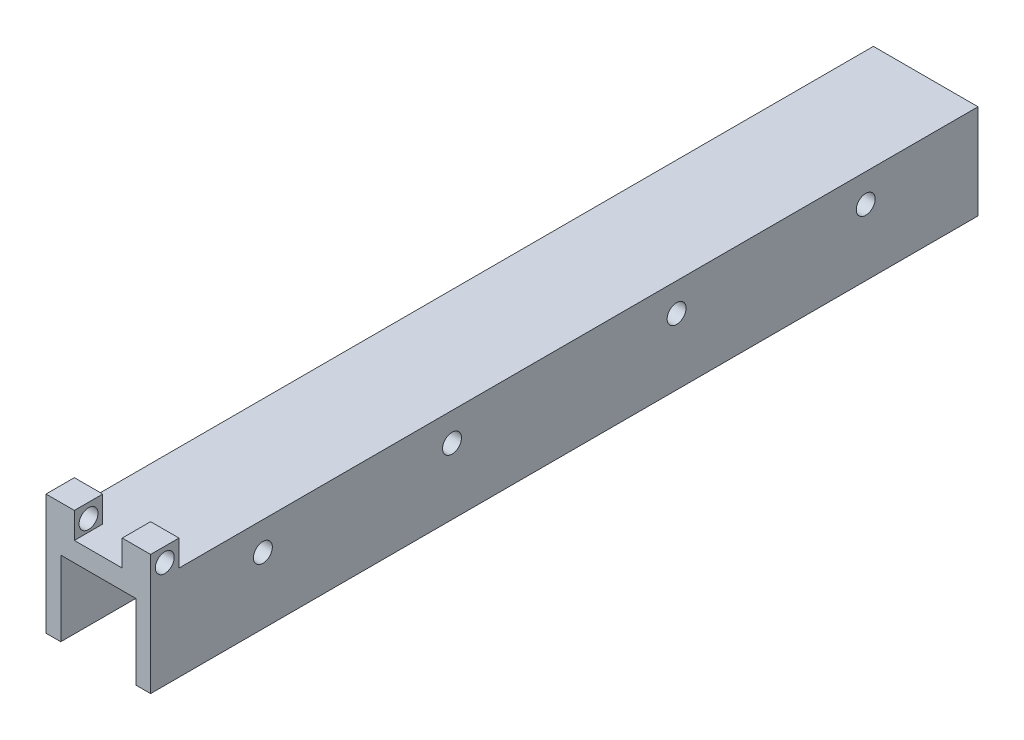
from build123d import *

# Parameters (mm, degrees)
BOSS_EXTRUDE2_DEPTH     = 177.8
SKETCH19_R              = 2.032
CUT_EXTRUDE3_DEPTH      = 181.363654435
SKETCH21_W              = 6.096
SKETCH21_H              = 6.096
BOSS_EXTRUDE4_DEPTH     = 5.588
CUT_EXTRUDE4_DEPTH      = 181.423022791
CUT_EXTRUDE4_DEPTH_BACK = 181.423022791
SKETCH22_R              = 2.032


with BuildPart() as part:
    # Sketch2 → Boss-Extrude2 (new body)
    with BuildSketch(Plane.XY):
        Polygon((0, 0), (0, 20.32), (22.479, 20.32), (22.479, 0), (19.304, 0), (19.304, 16.129), (3.175, 16.129), (3.175, 0), align=None)
    extrude(amount=-BOSS_EXTRUDE2_DEPTH)

    # Sketch19 → Cut-Extrude3 (cut, through all)
    with BuildSketch(Plane(origin=(0, 0, 0), x_dir=(0, 0, -1), z_dir=(1, 0, 0))):
        with Locations((24.13, 14.224)):
            Circle(SKETCH19_R)
        with Locations((64.77, 14.224)):
            Circle(SKETCH19_R)
        with Locations((113.03, 14.224)):
            Circle(SKETCH19_R)
        with Locations((153.67, 14.224)):
            Circle(SKETCH19_R)
    extrude(amount=CUT_EXTRUDE3_DEPTH, mode=Mode.SUBTRACT)

    # Sketch21 → Boss-Extrude4 (add)
    with BuildSketch(Plane(origin=(0, 20.32, 0), x_dir=(1, 0, 0), z_dir=(0, 1, 0))):
        with Locations((3.048, 3.048)):
            Rectangle(SKETCH21_W, SKETCH21_H)
        with Locations((19.431, 3.048)):
            Rectangle(SKETCH21_W, SKETCH21_H)
    extrude(amount=BOSS_EXTRUDE4_DEPTH)

    # Sketch22 → Cut-Extrude4 (cut, two sides: drawn at the far end of the back side and taken through both)
    with BuildSketch(Plane.ZY.offset(-16.383).offset(-CUT_EXTRUDE4_DEPTH_BACK)):
        with Locations((-3.048, 22.86)):
            Circle(SKETCH22_R)
    extrude(amount=CUT_EXTRUDE4_DEPTH + CUT_EXTRUDE4_DEPTH_BACK, mode=Mode.SUBTRACT)


solid = part.part
